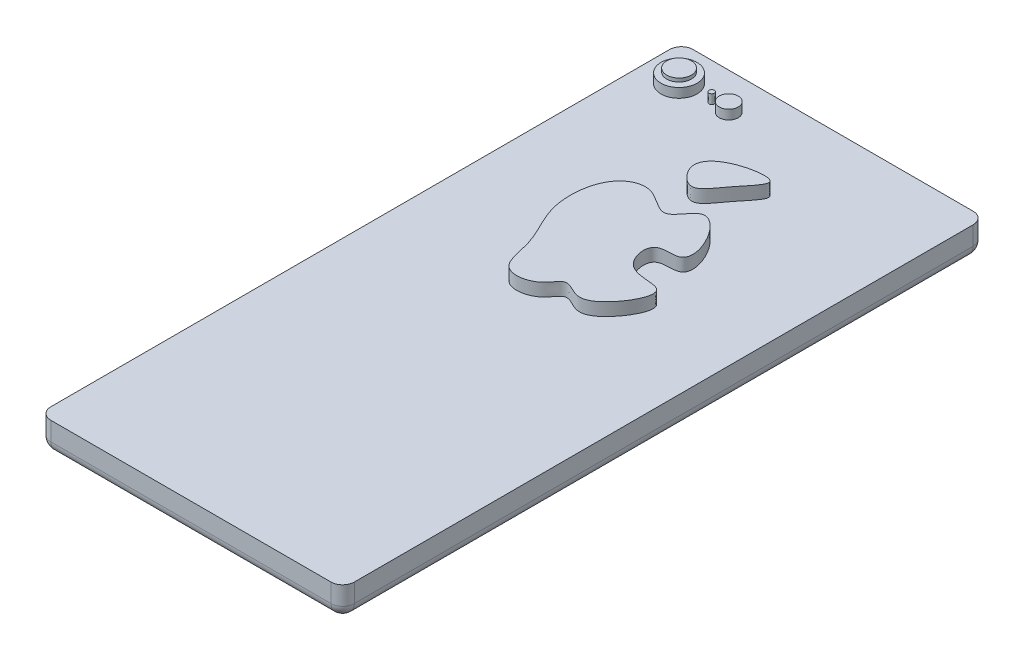
from build123d import *

# Parameters (mm, degrees)
BOSS_EXTRUDE1_DEPTH = 6.604
SKETCH2_R           = 3.919504197
SKETCH2_R_2         = 0.566443641
SKETCH2_R_3         = 2.065239225
BOSS_EXTRUDE2_DEPTH = 2.032
SKETCH3_W           = 60.9169051
SKETCH3_H           = 106.860686568
CUT_EXTRUDE1_DEPTH  = 2.032
SKETCH4_R           = 5.367061821
CUT_EXTRUDE2_DEPTH  = 1.27
SKETCH5_R           = 1.27
SKETCH5_R_2         = 1.228205677
SKETCH5_W           = 11.5062
SKETCH5_H           = 1.27
CUT_EXTRUDE3_DEPTH  = 1.016
FILLET1_R           = 2.54
SKETCH7_R           = 2.94444965
CUT_EXTRUDE4_DEPTH  = 2.54
SKETCH8_R           = 2.684422541
BOSS_EXTRUDE3_DEPTH = 0.762
BOSS_EXTRUDE4_DEPTH = 2.794


with BuildPart() as part:
    # Sketch1 → Boss-Extrude1 (new body)
    with BuildSketch(Plane(origin=(0, 0, 0), x_dir=(1, 0, 0), z_dir=(0, 1, 0))):
        with BuildLine():
            Line((-43.10281748, 37.544399845), (-43.10281748, -97.006983228))
            ThreePointArc((-43.10281748, -97.006983228), (-42.358868704, -98.803034452), (-40.56281748, -99.546983228))
            Line((-40.56281748, -99.546983228), (20.35408762, -99.546983228))
            ThreePointArc((20.35408762, -99.546983228), (22.150138844, -98.803034452), (22.89408762, -97.006983228))
            Line((22.89408762, -97.006983228), (22.89408762, 37.544399845))
            ThreePointArc((22.89408762, 37.544399845), (22.150138844, 39.340451069), (20.35408762, 40.084399845))
            Line((20.35408762, 40.084399845), (-40.56281748, 40.084399845))
            ThreePointArc((-40.56281748, 40.084399845), (-42.358868704, 39.340451069), (-43.10281748, 37.544399845))
        make_face()
    extrude(amount=BOSS_EXTRUDE1_DEPTH)

    # Sketch2 → Boss-Extrude2 (add)
    with BuildSketch(Plane(origin=(0, 6.604, 0), x_dir=(1, 0, 0), z_dir=(0, 1, 0))):
        with Locations(Location((-35.663139583, 32.138490209, 0), (0, 0, 270))):
            Circle(SKETCH2_R)
        with Locations(Location((-28.54550888, 32.138490209, 0), (0, 0, 270))):
            Circle(SKETCH2_R_2)
        with Locations(Location((-24.851263483, 32.138490209, 0), (0, 0, 270))):
            Circle(SKETCH2_R_3)
    extrude(amount=BOSS_EXTRUDE2_DEPTH)

    # Sketch3 → Cut-Extrude1 (cut)
    with BuildSketch(Plane(origin=(0, 0, 0), x_dir=(-1, 0, 0), z_dir=(0, -1, 0))):
        with Locations((10.10436493, -28.890743439)):
            Rectangle(SKETCH3_W, SKETCH3_H)
    extrude(amount=-CUT_EXTRUDE1_DEPTH, mode=Mode.SUBTRACT)

    # Sketch4 → Cut-Extrude2 (cut)
    with BuildSketch(Plane(origin=(0, 0, 0), x_dir=(-1, 0, 0), z_dir=(0, -1, 0))):
        with Locations(Location((8.85591238, -90.215843688, 0), (0, 0, 90))):
            Circle(SKETCH4_R)
    extrude(amount=-CUT_EXTRUDE2_DEPTH, mode=Mode.SUBTRACT)

    # Sketch5 → Cut-Extrude3 (cut)
    with BuildSketch(Plane(origin=(0, 0, 0), x_dir=(-1, 0, 0), z_dir=(0, -1, 0))):
        with Locations(Location((-2.888143629, 31.397599845, 0), (0, 0, 90))):
            Circle(SKETCH5_R)
        with Locations(Location((8.17011238, 34.649772777, 0), (0, 0, 90))):
            Circle(SKETCH5_R_2)
        with Locations((6.979145606, 32.108799845)):
            Rectangle(SKETCH5_W, SKETCH5_H)
    extrude(amount=-CUT_EXTRUDE3_DEPTH, mode=Mode.SUBTRACT)

    # Fillet1
    fillet1_edges = [part.edges().sort_by_distance(p)[0] for p in [
        (-10.10436493, 0, 99.546983228),
        (-42.358868704, 0, 98.803034452),
        (-43.10281748, 0, 29.731291691),
        (-42.358868704, 0, -39.340451069),
        (-10.10436493, 0, -40.084399845),
        (22.150138844, 0, -39.340451069),
        (22.89408762, 0, 29.731291691),
        (22.150138844, 0, 98.803034452),
    ]]
    fillet(fillet1_edges, radius=FILLET1_R - 0.0001)  # a hair under: the kernel refuses the full size

    # Sketch7 → Cut-Extrude4 (cut)
    with BuildSketch(Plane(origin=(0, 6.604, 0), x_dir=(1, 0, 0), z_dir=(0, 1, 0))):
        with Locations(Location((-35.727053618, 32.230916755, 0), (0, 0, 270))):
            Circle(SKETCH7_R)
    extrude(amount=-CUT_EXTRUDE4_DEPTH, mode=Mode.SUBTRACT)

    # Sketch8 → Boss-Extrude3 (add)
    with BuildSketch(Plane(origin=(0, 8.636, 0), x_dir=(1, 0, 0), z_dir=(0, 1, 0))):
        with Locations(Location((-35.807369042, 32.29345464, 0), (0, 0, 270))):
            Circle(SKETCH8_R)
    extrude(amount=BOSS_EXTRUDE3_DEPTH)

    # Sketch9 → Boss-Extrude4 (add)
    with BuildSketch(Plane(origin=(0, 6.604, 0), x_dir=(1, 0, 0), z_dir=(0, 1, 0))):
        with BuildLine():
            add(Edge.make_bspline(
                [(-7.80056122, -20.400886664), (-6.853360215, -20.178132505), (-3.922309563, -22.559935581), (1.360717881, -19.787898202), (6.834958004, -9.595166337), (-4.531339922, -12.448510053), (-6.44086429, -2.492436288), (4.901372473, -5.250452874), (-4.864824897, 12.659038777), (-9.601591513, 0.785158014), (-14.758268239, 6.889505713), (-23.234536447, 5.313079767), (-24.998229305, -7.882064839), (-18.817560553, -15.369837595), (-18.02361733, -25.428704355), (-10.373296019, -24.261756275), (-8.647763554, -20.600124041), (-7.80056122, -20.400886664)],
                knots=[0, 0, 0, 0, 0.03510517, 0.079769117, 0.16443694, 0.236106534, 0.292318671, 0.337297107, 0.45144008, 0.503272243, 0.568002979, 0.603803369, 0.733112444, 0.840719956, 0.905450692, 0.968600981, 1, 1, 1, 1], degree=3))
        make_face()
        with BuildLine():
            add(Edge.make_bspline(
                [(-9.643604188, 20.837199752), (-13.307399758, 19.890492956), (-18.362036209, 16.557305032), (-11.701266913, 9.334871489), (-8.26923518, 15.538956926), (-2.186712873, 21.75435962), (-7.453097508, 21.403215929), (-9.643604188, 20.837199752)],
                knots=[0, 0, 0, 0, 0.273456617, 0.436443121, 0.636405543, 0.836506013, 1, 1, 1, 1], degree=3))
        make_face()
    extrude(amount=BOSS_EXTRUDE4_DEPTH)


solid = part.part
